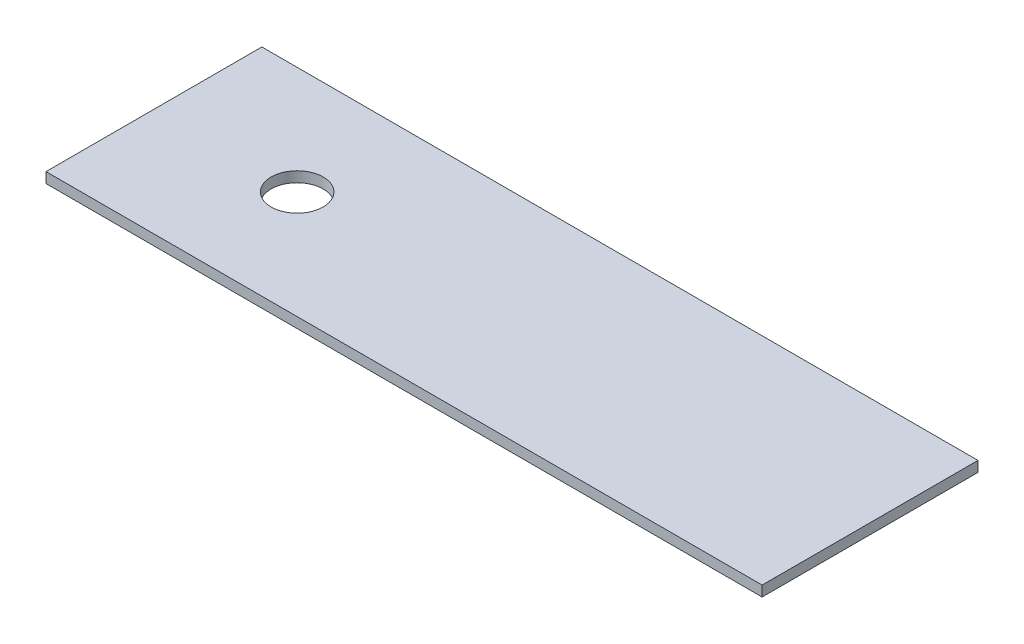
from build123d import *

# Parameters (mm, degrees)
SKETCH1_W           = 413
SKETCH1_H           = 124.5
SKETCH1_R           = 15
BOSS_EXTRUDE1_DEPTH = 6


with BuildPart() as part:
    # Sketch1 → Boss-Extrude1 (new body)
    with BuildSketch(Plane(origin=(0, 0, 0), x_dir=(1, 0, 0), z_dir=(0, 1, 0))):
        Rectangle(SKETCH1_W, SKETCH1_H)
        with Locations((-123.9, 0)):
            Circle(SKETCH1_R, mode=Mode.SUBTRACT)
    extrude(amount=BOSS_EXTRUDE1_DEPTH)


solid = part.part
